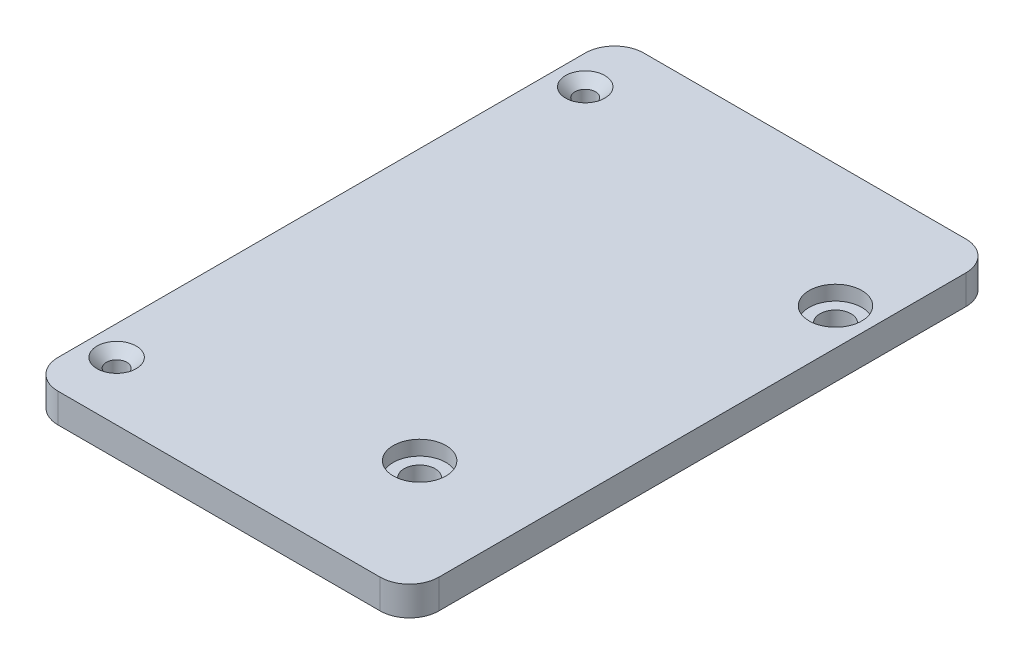
from build123d import *

# Parameters (mm, degrees)
SKETCH2_W           = 65
SKETCH2_H           = 100
SKETCH2_R           = 1.75
SKETCH2_R_2         = 2.65
BOSS_EXTRUDE1_DEPTH = 5
SKETCH3_R           = 4.5
CUT_EXTRUDE1_DEPTH  = 2.5
FILLET1_R           = 5
CHAMFER1_SIZE       = 1.6


with BuildPart() as part:
    # Sketch2 → Boss-Extrude1 (new body)
    with BuildSketch(Plane(origin=(0, 0, 0), x_dir=(1, 0, 0), z_dir=(0, 1, 0))):
        Rectangle(SKETCH2_W, SKETCH2_H)
        with Locations((-27.5, 40)):
            Circle(SKETCH2_R, mode=Mode.SUBTRACT)
        with Locations((-27.5, -40)):
            Circle(SKETCH2_R, mode=Mode.SUBTRACT)
        with Locations((26.23, 29)):
            Circle(SKETCH2_R_2, mode=Mode.SUBTRACT)
        with Locations((13.65, -29.42)):
            Circle(SKETCH2_R_2, mode=Mode.SUBTRACT)
    extrude(amount=BOSS_EXTRUDE1_DEPTH)

    # Sketch3 → Cut-Extrude1 (cut)
    with BuildSketch(Plane(origin=(0, 5, 0), x_dir=(1, 0, 0), z_dir=(0, 1, 0))):
        with Locations((26.23, 29)):
            Circle(SKETCH3_R)
        with Locations((13.65, -29.42)):
            Circle(SKETCH3_R)
    extrude(amount=-CUT_EXTRUDE1_DEPTH, mode=Mode.SUBTRACT)

    # Fillet1
    fillet1_edges = [part.edges().sort_by_distance(p)[0] for p in [
        (32.5, 2.5, 50),
        (-32.5, 2.5, -50),
        (32.5, 2.5, -50),
        (-32.5, 2.5, 50),
    ]]
    fillet(fillet1_edges, radius=FILLET1_R)

    # Chamfer1
    chamfer1_edges = [part.edges().sort_by_distance(p)[0] for p in [
        (-29.25, 5, 40),
        (-29.25, 5, -40),
    ]]
    chamfer(chamfer1_edges, length=CHAMFER1_SIZE)


solid = part.part
